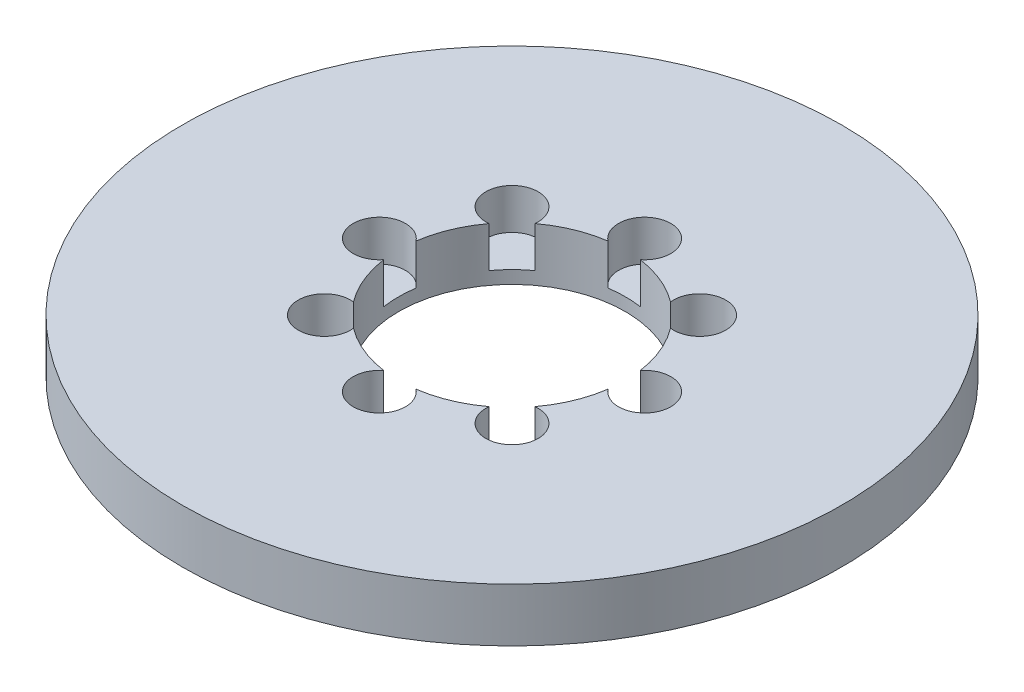
from build123d import *

# Parameters (mm, degrees)
SKETCH1_R           = 80
BOSS_EXTRUDE1_DEPTH = 13
SKETCH2_R           = 27.5
CUT_EXTRUDE1_DEPTH  = 114.881517377
SKETCH3_R           = 6.34490202
CUT_EXTRUDE2_DEPTH  = 9.877393525
CIRPATTERN1_COUNT   = 8


with BuildPart() as part:
    # Sketch1 → Boss-Extrude1 (new body)
    with BuildSketch(Plane(origin=(0, 0, 0), x_dir=(1, 0, 0), z_dir=(0, 1, 0))):
        Circle(SKETCH1_R)
    extrude(amount=BOSS_EXTRUDE1_DEPTH)

    # Sketch2 → Cut-Extrude1 (cut, through all)
    with BuildSketch(Plane(origin=(0, 0, 0), x_dir=(1, 0, 0), z_dir=(0, 1, 0))):
        Circle(SKETCH2_R)
    extrude(amount=CUT_EXTRUDE1_DEPTH, mode=Mode.SUBTRACT)

    # Sketch3 → Cut-Extrude2 (cut)
    with BuildSketch(Plane(origin=(0, 13, 0), x_dir=(1, 0, 0), z_dir=(0, 1, 0))):
        with Locations((-32.20416553, 0)):
            Circle(SKETCH3_R)
    cut_extrude2 = extrude(amount=-CUT_EXTRUDE2_DEPTH, mode=Mode.SUBTRACT)

    # CirPattern1: Cut-Extrude2 ×8 about axis
    cirpattern1_axis = Axis((0, 0, 0), (0, 1, 0))
    for i in range(1, CIRPATTERN1_COUNT):
        add(cut_extrude2.rotate(cirpattern1_axis, i * 360 / CIRPATTERN1_COUNT), mode=Mode.SUBTRACT)


solid = part.part
